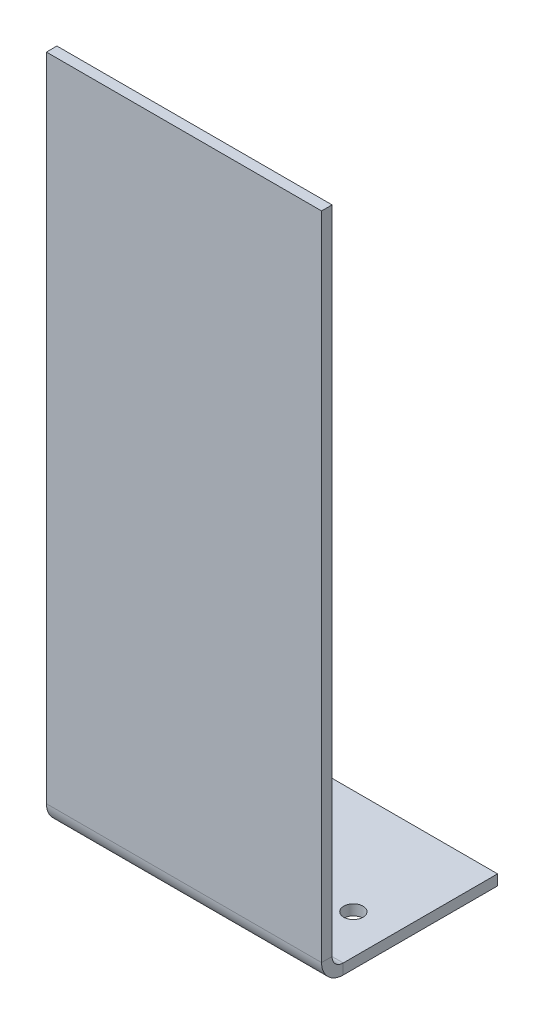
from build123d import *

# Parameters (mm, degrees)
SKETCH1_W              = 42
SKETCH1_H              = 126.6
SKETCH1_R              = 1.4732
BASE_FLANGE1_DEPTH     = 1.6002
SKETCHED_BEND1_DEPTH   = 42
SKETCHED_BEND1_2_DEPTH = 42


# Read off the part's stored shape, not the designer's step: Sketched Bend1
# Sheet-metal steps are written as plain solids
with BuildPart() as part:
    # Sketch1 → Base-Flange1 (new body)
    with BuildSketch(Plane(origin=(0, 0, 0), x_dir=(1, 0, 0), z_dir=(0, 1, 0))):
        with Locations((21, -63.3)):
            Rectangle(SKETCH1_W, SKETCH1_H)
        with Locations(Location((6, -16.01, 0), (0, 0, 270))):
            Circle(SKETCH1_R, mode=Mode.SUBTRACT)
        with Locations(Location((36, -16.01, 0), (0, 0, 270))):
            Circle(SKETCH1_R, mode=Mode.SUBTRACT)
    extrude(amount=-BASE_FLANGE1_DEPTH)

    # Sketched Bend1 outline → Sketched Bend1 (cut)
    with BuildSketch(Plane.YZ):
        with BuildLine():
            ThreePointArc((-1.6002, 23.562105466), (-1.172425807, 25.187063933), (0, 26.390765933))
            Line((0, 26.390765933), (0, 126.6))
            Line((0, 126.6), (-1.6002, 126.6))
            Line((-1.6002, 126.6), (-1.6002, 23.562105466))
        make_face()
    extrude(amount=SKETCHED_BEND1_DEPTH, mode=Mode.SUBTRACT)

    # Sketched Bend1 2 outline → Sketched Bend1 2 (add)
    with BuildSketch(Plane.YZ):
        with BuildLine():
            ThreePointArc((0, 23.562105466), (0.497918472, 24.764186994), (1.7, 25.262105466))
            Line((1.7, 25.262105466), (101.062105466, 25.262105466))
            Line((101.062105466, 25.262105466), (101.062105466, 26.862305466))
            Line((101.062105466, 26.862305466), (1.7, 26.862305466))
            ThreePointArc((1.7, 26.862305466), (0.817907384, 26.742236384), (0, 26.390765933))
            Line((0, 26.390765933), (0, 23.562105466))
        make_face()
    extrude(amount=SKETCHED_BEND1_2_DEPTH)


solid = part.part
